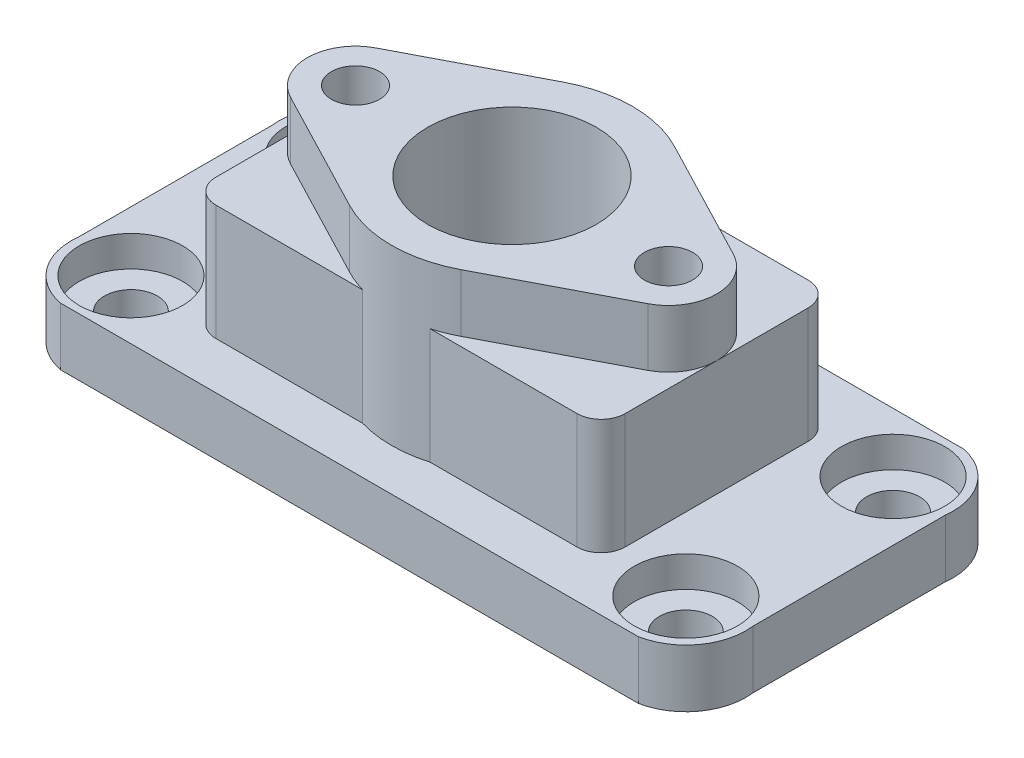
from build123d import *

# Parameters (mm, degrees)
BOSS_EXTRUDE1_DEPTH                           = 12
CBORE_FOR_M10_HEX_HEAD_CAP_SCREW1_D           = 11
CBORE_FOR_M10_HEX_HEAD_CAP_SCREW1_CBORE_D     = 21.475
CBORE_FOR_M10_HEX_HEAD_CAP_SCREW1_CBORE_DEPTH = 6.4
SKETCH4_R                                     = 17.5
BOSS_EXTRUDE3_DEPTH                           = 24
SKETCH7_R                                     = 5
SKETCH7_R_2                                   = 17.5
BOSS_EXTRUDE4_DEPTH                           = 12
SKETCH8_R                                     = 17.5
SKETCH8_R_2                                   = 5
CUT_EXTRUDE2_DEPTH                            = 92.413676108


with BuildPart() as part:
    # Sketch1 → Boss-Extrude1 (new body)
    with BuildSketch(Plane(origin=(0, 0, 0), x_dir=(1, 0, 0), z_dir=(0, 1, 0))):
        with BuildLine():
            Line((-60, -33.757736606), (60, -33.757736606))
            ThreePointArc((60, -33.757736606), (67.707641844, -28.846955004), (70, -20))
            Line((70, -20), (70, 20))
            ThreePointArc((70, 20), (67.707641844, 28.846955004), (60, 33.757736606))
            Line((60, 33.757736606), (-60, 33.757736606))
            ThreePointArc((-60, 33.757736606), (-67.707641844, 28.846955004), (-70, 20))
            Line((-70, 20), (-70, -20))
            ThreePointArc((-70, -20), (-67.707641844, -28.846955004), (-60, -33.757736606))
        make_face()
    extrude(amount=BOSS_EXTRUDE1_DEPTH)

    # CBORE for M10 Hex Head Cap Screw1 (through all)
    with Locations(Plane(origin=(-57.615806102, 12, -21.511565447), x_dir=(0, 0, 1), z_dir=(0, 1, 0))):
        with Locations((0, 0), (43.023130894, 0), (43.023130894, 115.231612204), (0, 115.231612204)):
            CounterBoreHole(CBORE_FOR_M10_HEX_HEAD_CAP_SCREW1_D / 2, CBORE_FOR_M10_HEX_HEAD_CAP_SCREW1_CBORE_D / 2, CBORE_FOR_M10_HEX_HEAD_CAP_SCREW1_CBORE_DEPTH)

    # Sketch4 → Boss-Extrude3 (add)
    with BuildSketch(Plane(origin=(0, 12, 0), x_dir=(1, 0, 0), z_dir=(0, 1, 0))):
        with BuildLine():
            Line((-7, 24), (-37.5, 24))
            ThreePointArc((-37.5, 24), (-41.035533906, 22.535533906), (-42.5, 19))
            Line((-42.5, 19), (-42.5, -19))
            ThreePointArc((-42.5, -19), (-41.035533906, -22.535533906), (-37.5, -24))
            Line((-37.5, -24), (-7, -24))
            ThreePointArc((-7, -24), (0, -25), (7, -24))
            Line((7, -24), (37.5, -24))
            ThreePointArc((37.5, -24), (41.035533906, -22.535533906), (42.5, -19))
            Line((42.5, -19), (42.5, 19))
            ThreePointArc((42.5, 19), (41.035533906, 22.535533906), (37.5, 24))
            Line((37.5, 24), (7, 24))
            ThreePointArc((7, 24), (0, 25), (-7, 24))
        make_face()
        Circle(SKETCH4_R, mode=Mode.SUBTRACT)
    extrude(amount=BOSS_EXTRUDE3_DEPTH)

    # Sketch7 → Boss-Extrude4 (add)
    with BuildSketch(Plane(origin=(0, 36, 0), x_dir=(1, 0, 0), z_dir=(0, 1, 0))):
        with BuildLine():
            ThreePointArc((37.115384615, -8.871201996), (42.5, 0), (37.115384615, 8.871201996))
            Line((37.115384615, 8.871201996), (11.538461538, 22.17800499))
            ThreePointArc((11.538461538, 22.17800499), (0, 25), (-11.538461538, 22.17800499))
            Line((-11.538461538, 22.17800499), (-37.115384615, 8.871201996))
            ThreePointArc((-37.115384615, 8.871201996), (-42.5, 0), (-37.115384615, -8.871201996))
            Line((-37.115384615, -8.871201996), (-11.538461538, -22.17800499))
            ThreePointArc((-11.538461538, -22.17800499), (0, -25), (11.538461538, -22.17800499))
            Line((11.538461538, -22.17800499), (37.115384615, -8.871201996))
        make_face()
        with Locations((32.5, 0)):
            Circle(SKETCH7_R, mode=Mode.SUBTRACT)
        Circle(SKETCH7_R_2, mode=Mode.SUBTRACT)
        with Locations((-32.5, 0)):
            Circle(SKETCH7_R, mode=Mode.SUBTRACT)
    extrude(amount=BOSS_EXTRUDE4_DEPTH)

    # Sketch8 → Cut-Extrude2 (cut, through all)
    with BuildSketch(Plane(origin=(0, 48, 0), x_dir=(1, 0, 0), z_dir=(0, 1, 0))):
        Circle(SKETCH8_R)
        with Locations((32.5, 0)):
            Circle(SKETCH8_R_2)
        with Locations((-32.5, 0)):
            Circle(SKETCH8_R_2)
    extrude(amount=-CUT_EXTRUDE2_DEPTH, mode=Mode.SUBTRACT)


solid = part.part
